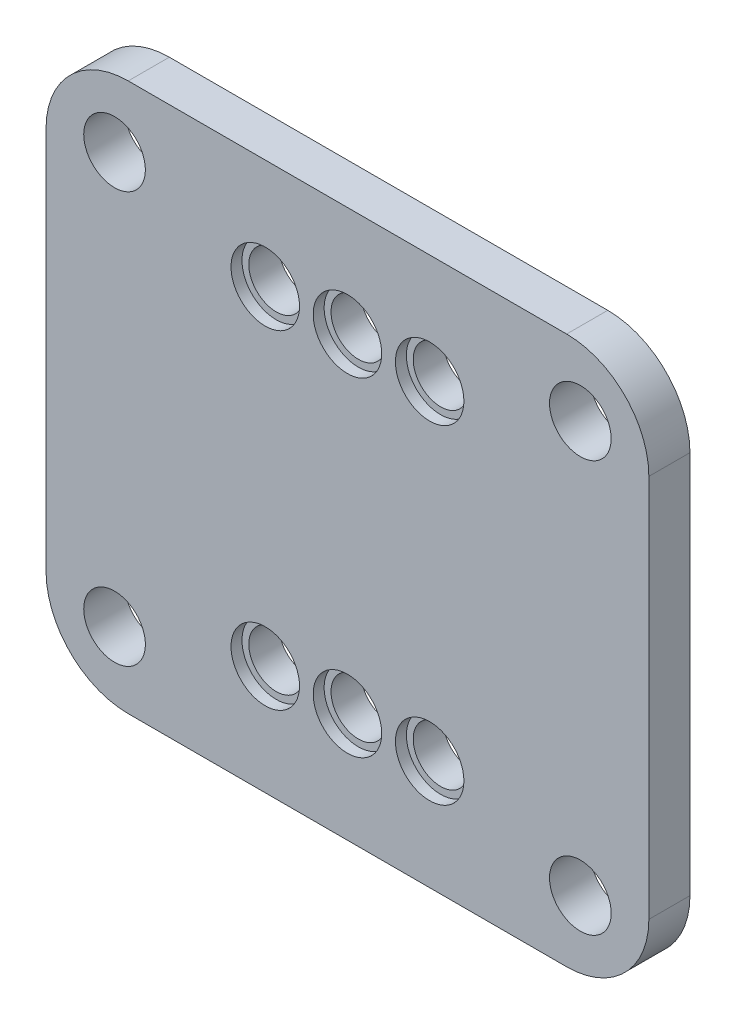
from build123d import *

# Parameters (mm, degrees)
ESQUISSE2_W                  = 44
ESQUISSE2_H                  = 40
BOSS_EXTRU_1_DEPTH           = 3
ENL_V_MAT_EXTRU_1_DEPTH      = 60.539902586
ENL_V_MAT_EXTRU_1_DEPTH_BACK = 60.539902586
ESQUISSE3_R                  = 2
ESQUISSE3_R_2                = 2.25
CONG_1_R                     = 6
ESQUISSE4_R                  = 2.5
ENL_V_MAT_EXTRU_2_DEPTH      = 0.8


with BuildPart() as part:
    # Esquisse2 → Boss.-Extru.1 (new body)
    with BuildSketch(Plane.XY):
        with Locations((22, 20)):
            Rectangle(ESQUISSE2_W, ESQUISSE2_H)
    extrude(amount=BOSS_EXTRU_1_DEPTH)

    # Esquisse3 → Enlèv. mat.-Extru.1 (cut, two sides: drawn at the far end of the back side and taken through both)
    with BuildSketch(Plane.XY.offset(3).offset(-ENL_V_MAT_EXTRU_1_DEPTH_BACK)):
        with Locations((22, 32)):
            Circle(ESQUISSE3_R)
        with Locations((16, 32)):
            Circle(ESQUISSE3_R)
        with Locations((28, 32)):
            Circle(ESQUISSE3_R)
        with Locations((28, 8)):
            Circle(ESQUISSE3_R)
        with Locations((16, 8)):
            Circle(ESQUISSE3_R)
        with Locations((22, 8)):
            Circle(ESQUISSE3_R)
        with Locations((5, 35)):
            Circle(ESQUISSE3_R_2)
        with Locations((5, 5)):
            Circle(ESQUISSE3_R_2)
        with Locations((39, 5)):
            Circle(ESQUISSE3_R_2)
        with Locations((39, 35)):
            Circle(ESQUISSE3_R_2)
    extrude(amount=ENL_V_MAT_EXTRU_1_DEPTH + ENL_V_MAT_EXTRU_1_DEPTH_BACK, mode=Mode.SUBTRACT)

    # Congé1
    cong_1_edges = [part.edges().sort_by_distance(p)[0] for p in [
        (0, 40, 1.5),
        (0, 0, 1.5),
        (44, 0, 1.5),
        (44, 40, 1.5),
    ]]
    fillet(cong_1_edges, radius=CONG_1_R)

    # Esquisse4 → Enlèv. mat.-Extru.2 (cut)
    with BuildSketch(Plane.XY.offset(3)):
        with Locations((16, 8)):
            Circle(ESQUISSE4_R)
        with Locations((22, 8)):
            Circle(ESQUISSE4_R)
        with Locations((28, 8)):
            Circle(ESQUISSE4_R)
        with Locations((28, 32)):
            Circle(ESQUISSE4_R)
        with Locations((22, 32)):
            Circle(ESQUISSE4_R)
        with Locations((16, 32)):
            Circle(ESQUISSE4_R)
    extrude(amount=-ENL_V_MAT_EXTRU_2_DEPTH, mode=Mode.SUBTRACT)


solid = part.part
